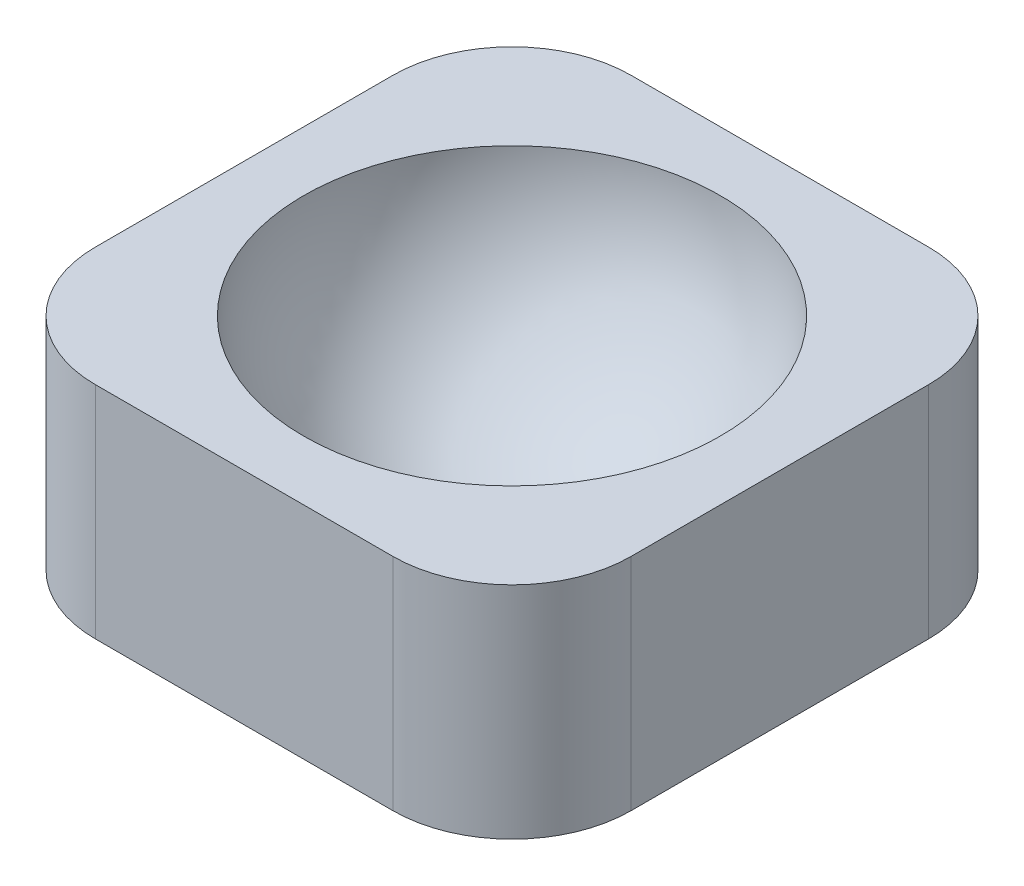
from build123d import *

# Parameters (mm, degrees)
SKETCH1_W           = 114.3
SKETCH1_H           = 114.3
BOSS_EXTRUDE1_DEPTH = 46.99
CUT_REVOLVE1_ANGLE  = 180
FILLET1_R           = 25.4


with BuildPart() as part:
    # Sketch1 → Boss-Extrude1 (new body)
    with BuildSketch(Plane(origin=(0, 0, 0), x_dir=(1, 0, 0), z_dir=(0, 1, 0))):
        with Locations((-57.15, 57.15)):
            Rectangle(SKETCH1_W, SKETCH1_H)
    extrude(amount=BOSS_EXTRUDE1_DEPTH)

    # Sketch2 → Cut-Revolve1 (revolve, cut)
    with BuildSketch(Plane(origin=(0, 46.99, 0), x_dir=(1, 0, 0), z_dir=(0, 1, 0))):
        with BuildLine():
            ThreePointArc((-12.7, 57.15), (-25.719103576, 88.580896424), (-57.15, 101.6))
            Line((-57.15, 101.6), (-57.15, 12.7))
            ThreePointArc((-57.15, 12.7), (-25.719103576, 25.719103576), (-12.7, 57.15))
        make_face()
    revolve(axis=Axis((-57.15, 46.99, -114.3), (0, 0, -1)), revolution_arc=CUT_REVOLVE1_ANGLE, mode=Mode.SUBTRACT)

    # Fillet1
    fillet1_edges = [part.edges().sort_by_distance(p)[0] for p in [
        (0, 23.495, 0),
        (-114.3, 23.495, 0),
        (-114.3, 23.495, -114.3),
        (0, 23.495, -114.3),
    ]]
    fillet(fillet1_edges, radius=FILLET1_R)


solid = part.part
